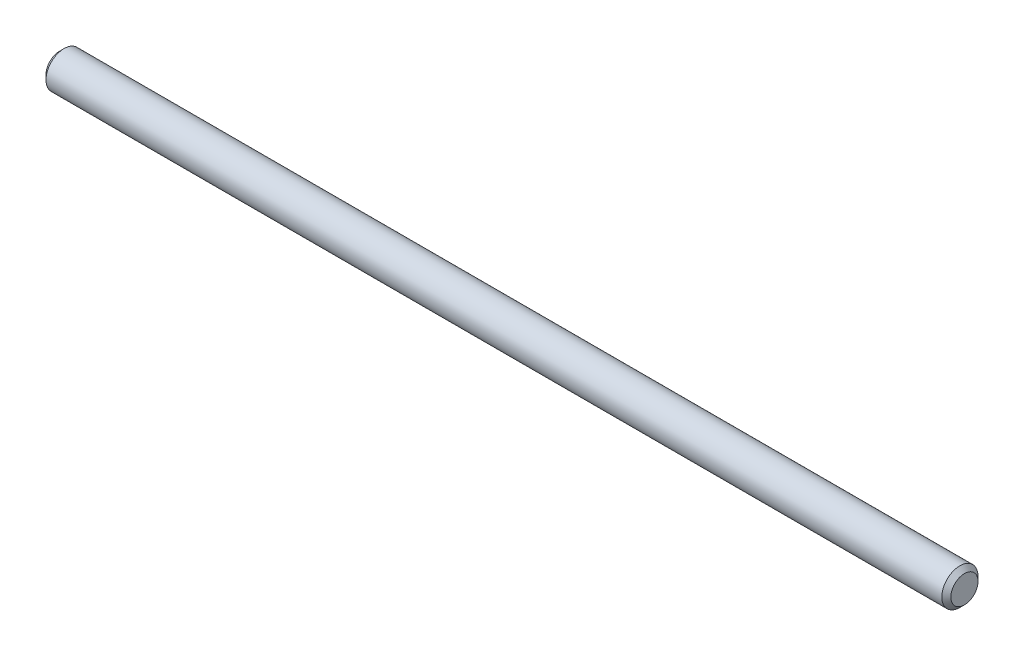
from build123d import *

# Parameters (mm, degrees)
CROQUIS1_R              = 4
SALIENTE_EXTRUIR1_DEPTH = 200
CHAFL_N1_SIZE           = 1
CHAFL_N2_SIZE           = 1


with BuildPart() as part:
    # Croquis1 → Saliente-Extruir1 (new body)
    with BuildSketch(Plane(origin=(0, 0, 0), x_dir=(0, 0, -1), z_dir=(1, 0, 0))):
        Circle(CROQUIS1_R)
    extrude(amount=SALIENTE_EXTRUIR1_DEPTH)

    # Chaflán1
    chafl_n1_edges = [part.edges().sort_by_distance(p)[0] for p in [
        (200, 0, 4),
    ]]
    chamfer(chafl_n1_edges, length=CHAFL_N1_SIZE)

    # Chaflán2
    chafl_n2_edges = [part.edges().sort_by_distance(p)[0] for p in [
        (0, 0, 4),
    ]]
    chamfer(chafl_n2_edges, length=CHAFL_N2_SIZE)


solid = part.part
